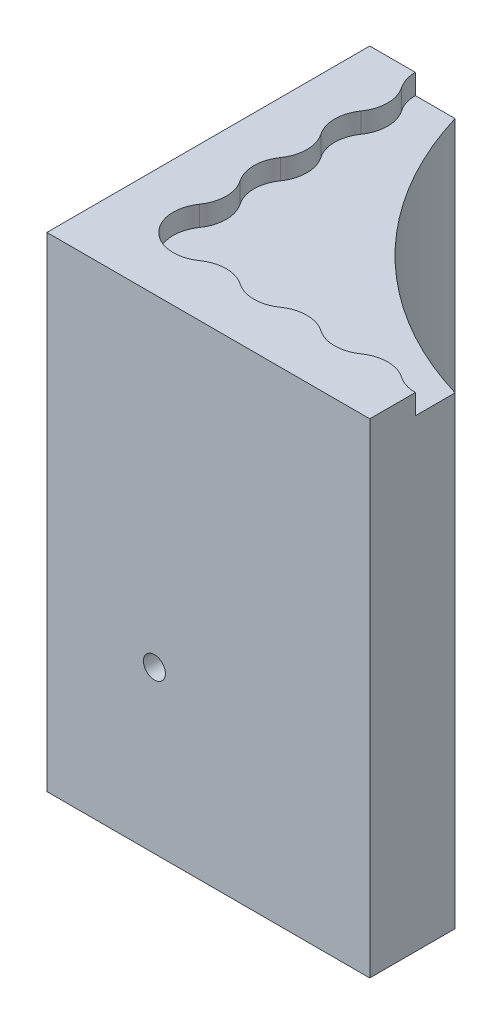
from build123d import *

# Parameters (mm, degrees)
SKETCH1_W                 = 50.8
SKETCH1_H                 = 50.8
BOSS_EXTRUDE1_DEPTH       = 76.2
CUT_EXTRUDE1_DEPTH        = 3.175
SKETCH3_R                 = 55.5625
CUT_EXTRUDE2_DEPTH        = 105.726882891
F_8_32_TAPPED_HOLE1_D     = 3.4544
F_8_32_TAPPED_HOLE1_DEPTH = 10.70864
F_8_32_TAPPED_HOLE1_TIP   = 1.037806461
F_8_32_TAPPED_HOLE2_D     = 3.4544
F_8_32_TAPPED_HOLE2_DEPTH = 10.70864
F_8_32_TAPPED_HOLE2_TIP   = 1.037806461


with BuildPart() as part:
    # Sketch1 → Boss-Extrude1 (new body)
    with BuildSketch(Plane(origin=(0, 0, 0), x_dir=(1, 0, 0), z_dir=(0, 1, 0))):
        with Locations((25.4, 25.4)):
            Rectangle(SKETCH1_W, SKETCH1_H)
    extrude(amount=BOSS_EXTRUDE1_DEPTH)

    # Sketch2 → Cut-Extrude1 (cut)
    with BuildSketch(Plane(origin=(0, 76.2, 0), x_dir=(1, 0, 0), z_dir=(0, 1, 0))):
        with BuildLine():
            Line((130.016993909, 125.017737196), (134.25782275, 78.573759143))
            ThreePointArc((134.25782275, 78.573759143), (134.034685181, 75.298190088), (132.798116214, 72.256802214))
            ThreePointArc((132.798116214, 72.256802214), (130.01096738, 66.280890285), (128.580118229, 59.844090402))
            ThreePointArc((128.580118229, 59.844090402), (125.846501332, 47.24207899), (120.576283082, 35.473130329))
            ThreePointArc((120.576283082, 35.473130329), (120.013426501, 34.114565768), (119.824473194, 32.656209898))
            ThreePointArc((119.824473194, 32.656209898), (117.90735564, 28.45485307), (113.469501546, 27.177281171))
            ThreePointArc((113.469501546, 27.177281171), (106.116591491, 23.83727612), (106.198458812, 15.761744078))
            ThreePointArc((106.198458812, 15.761744078), (105.465515747, 8.75311664), (98.443142857, 8.166309094))
            ThreePointArc((98.443142857, 8.166309094), (95.25, 9.168506799), (92.056857143, 8.166309094))
            ThreePointArc((92.056857143, 8.166309094), (88.9, 7.1755), (85.743142857, 8.166309094))
            ThreePointArc((85.743142857, 8.166309094), (82.55, 9.168506799), (79.356857143, 8.166309094))
            ThreePointArc((79.356857143, 8.166309094), (76.212257074, 7.175513597), (73.063291467, 8.152345678))
            ThreePointArc((73.063291467, 8.152345678), (69.907489389, 9.140393728), (66.74574768, 8.171520637))
            ThreePointArc((66.74574768, 8.171520637), (63.508942298, 7.175501389), (60.273525168, 8.176020964))
            ThreePointArc((60.273525168, 8.176020964), (57.10532095, 9.149271709), (53.943097961, 8.156759366))
            ThreePointArc((53.943097961, 8.156759366), (50.791625748, 7.175506347), (47.643142857, 8.166309094))
            ThreePointArc((47.643142857, 8.166309094), (44.45, 9.168506799), (41.256857143, 8.166309094))
            ThreePointArc((41.256857143, 8.166309094), (38.1, 7.1755), (34.943142857, 8.166309094))
            ThreePointArc((34.943142857, 8.166309094), (31.75, 9.168506799), (28.556857143, 8.166309094))
            ThreePointArc((28.556857143, 8.166309094), (25.4, 7.1755), (22.243142857, 8.166309094))
            ThreePointArc((22.243142857, 8.166309094), (19.05, 9.168506799), (15.856857143, 8.166309094))
            ThreePointArc((15.856857143, 8.166309094), (8.793588587, 8.793588587), (8.166309094, 15.856857143))
            ThreePointArc((8.166309094, 15.856857143), (9.168506799, 19.05), (8.166309094, 22.243142857))
            ThreePointArc((8.166309094, 22.243142857), (7.1755, 25.4), (8.166309094, 28.556857143))
            ThreePointArc((8.166309094, 28.556857143), (9.168506799, 31.75), (8.166309094, 34.943142857))
            ThreePointArc((8.166309094, 34.943142857), (7.1755, 38.1), (8.166309094, 41.256857143))
            ThreePointArc((8.166309094, 41.256857143), (9.168506799, 44.45), (8.166309094, 47.643142857))
            ThreePointArc((8.166309094, 47.643142857), (7.175506347, 50.791625748), (8.156759366, 53.943097961))
            ThreePointArc((8.156759366, 53.943097961), (9.149271709, 57.10532095), (8.176020964, 60.273525168))
            ThreePointArc((8.176020964, 60.273525168), (7.175501389, 63.508942298), (8.171520637, 66.74574768))
            ThreePointArc((8.171520637, 66.74574768), (9.140393728, 69.907489389), (8.152345678, 73.063291467))
            ThreePointArc((8.152345678, 73.063291467), (7.175513597, 76.212257074), (8.166309094, 79.356857143))
            ThreePointArc((8.166309094, 79.356857143), (9.168506799, 82.55), (8.166309094, 85.743142857))
            ThreePointArc((8.166309094, 85.743142857), (7.1755, 88.9), (8.166309094, 92.056857143))
            ThreePointArc((8.166309094, 92.056857143), (9.168506799, 95.25), (8.166309094, 98.443142857))
            ThreePointArc((8.166309094, 98.443142857), (8.75311664, 105.465515747), (15.761744078, 106.198458812))
            ThreePointArc((15.761744078, 106.198458812), (23.83727612, 106.116591491), (27.177281171, 113.469501546))
            ThreePointArc((27.177281171, 113.469501546), (28.45485307, 117.90735564), (32.656209898, 119.824473194))
            ThreePointArc((32.656209898, 119.824473194), (34.114565768, 120.013426501), (35.473130329, 120.576283082))
            ThreePointArc((35.473130329, 120.576283082), (47.24207899, 125.846501332), (59.844090402, 128.580118229))
            ThreePointArc((59.844090402, 128.580118229), (68.705211612, 130.952457845), (76.452938417, 135.863689229))
            ThreePointArc((76.452938417, 135.863689229), (80.625736152, 138.0725352), (85.345346996, 138.201045691))
            Line((85.345346996, 138.201045691), (125.626948268, 129.926898817))
            ThreePointArc((125.626948268, 129.926898817), (128.63345164, 128.197989094), (130.016993909, 125.017737196))
        make_face()
    extrude(amount=-CUT_EXTRUDE1_DEPTH, mode=Mode.SUBTRACT)

    # Sketch3 → Cut-Extrude2 (cut, through all)
    with BuildSketch(Plane(origin=(0, 76.2, 0), x_dir=(1, 0, 0), z_dir=(0, 1, 0))):
        with Locations((66.675, 66.675)):
            Circle(SKETCH3_R)
    extrude(amount=-CUT_EXTRUDE2_DEPTH, mode=Mode.SUBTRACT)

    # #8-32 Tapped Hole1
    with Locations(Plane(origin=(393.7, -15.875, 0), x_dir=(1, 0, 0), z_dir=(0, 0, 1))):
        with Locations((-376.782, 41.275)):
            Hole(F_8_32_TAPPED_HOLE1_D / 2, depth=F_8_32_TAPPED_HOLE1_DEPTH)
            with Locations((0, 0, -(F_8_32_TAPPED_HOLE1_DEPTH + F_8_32_TAPPED_HOLE1_TIP / 2))):  # 118° drill point
                Cone(0, F_8_32_TAPPED_HOLE1_D / 2, F_8_32_TAPPED_HOLE1_TIP, mode=Mode.SUBTRACT)

    # #8-32 Tapped Hole2
    with Locations(Plane(origin=(0, -15.875, -393.7), x_dir=(0, 0, 1), z_dir=(-1, 0, 0))):
        with Locations((374.968, 41.275)):
            Hole(F_8_32_TAPPED_HOLE2_D / 2, depth=F_8_32_TAPPED_HOLE2_DEPTH)
            with Locations((0, 0, -(F_8_32_TAPPED_HOLE2_DEPTH + F_8_32_TAPPED_HOLE2_TIP / 2))):  # 118° drill point
                Cone(0, F_8_32_TAPPED_HOLE2_D / 2, F_8_32_TAPPED_HOLE2_TIP, mode=Mode.SUBTRACT)


solid = part.part
